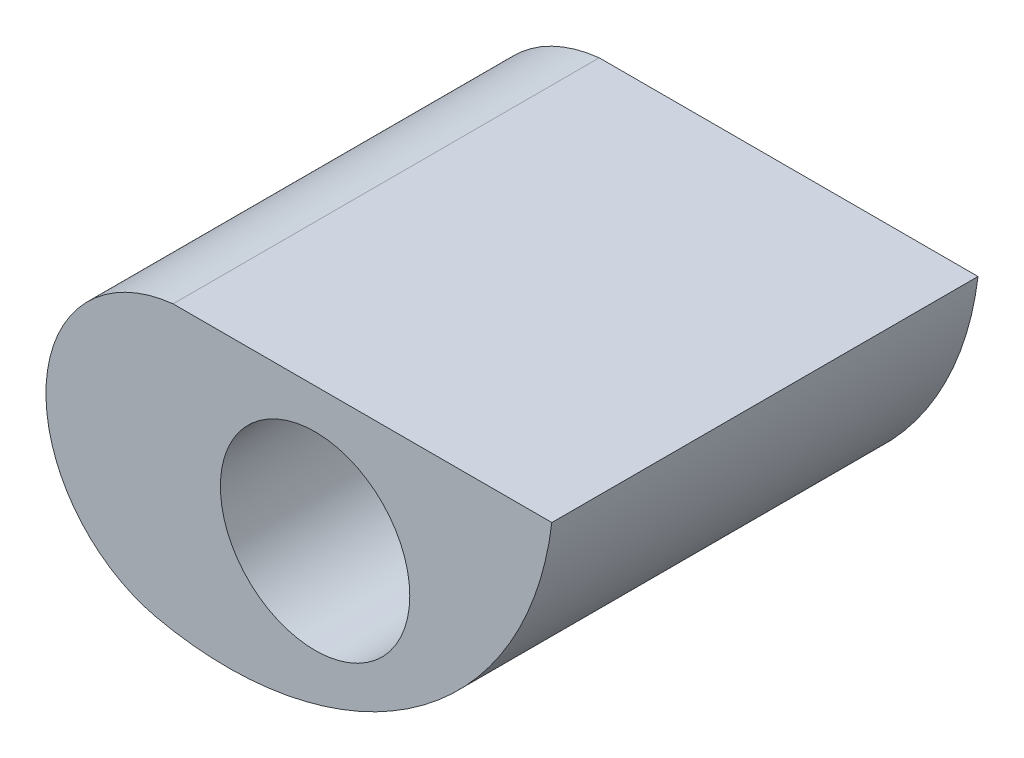
from build123d import *

# Parameters (mm, degrees)
BOSS_EXTRUDE1_DEPTH = 90
SHELL2_DEPTH        = 5
SKETCH4_R           = 20
CUT_EXTRUDE4_DEPTH  = 135.864371832
SKETCH5_R           = 22.5
SKETCH5_R_2         = 21
BOSS_EXTRUDE2_DEPTH = 3
CHAMFER1_SIZE       = 1
SKETCH6_R           = 20
BOSS_EXTRUDE3_DEPTH = 0.1
SKETCH7_R           = 5
CUT_EXTRUDE5_DEPTH  = 3


# Read off the part's stored shape, not the designer's step: Shell2
with BuildPart() as part:
    # Sketch2 → Boss-Extrude1 (new body)
    with BuildSketch(Plane.XY):
        with BuildLine():
            Line((80, 0), (0.013180824, 0))
            ThreePointArc((0.013180824, 0), (-26.775893479, -27.984672667), (-3.633537016, -59.052787248))
            ThreePointArc((-3.633537016, -59.052787248), (51.296073621, -48.097462301), (80, 0))
        make_face()
    extrude(amount=BOSS_EXTRUDE1_DEPTH)

    # Shell2 outline → Shell2 (cut)
    with BuildSketch(Plane.XY):
        with BuildLine():
            ThreePointArc((-3.187485366, -57.103146645), (49.216728462, -47.10575528), (77.70567898, -2))
            Line((77.70567898, -2), (0.120425847, -2))
            ThreePointArc((0.120425847, -2), (-24.782616289, -28.155901411), (-3.187485366, -57.103146645))
        make_face()
    extrude(amount=SHELL2_DEPTH, mode=Mode.SUBTRACT)

    # Sketch4 → Cut-Extrude4 (cut, through all)
    with BuildSketch(Plane.XY.offset(90)):
        with Locations((30, -28.386179716)):
            Circle(SKETCH4_R)
    extrude(amount=-CUT_EXTRUDE4_DEPTH, mode=Mode.SUBTRACT)

    # Sketch5 → Boss-Extrude2 (add)
    with BuildSketch(Plane(origin=(0, 0, 5), x_dir=(-1, 0, 0), z_dir=(0, 0, -1))):
        with Locations(Location((-30, -28.386179716, 0), (0, 0, 180))):
            Circle(SKETCH5_R)
        with Locations((-30, -28.386179716)):
            Circle(SKETCH5_R_2, mode=Mode.SUBTRACT)
    extrude(amount=BOSS_EXTRUDE2_DEPTH)

    # Chamfer1
    chamfer1_edges = [part.edges().sort_by_distance(p)[0] for p in [
        (51, -28.386179716, 2),
    ]]
    chamfer(chamfer1_edges, length=CHAMFER1_SIZE)

    # Sketch7 → Cut-Extrude5 (cut)
    with BuildSketch(Plane(origin=(0, 0, 5), x_dir=(-1, 0, 0), z_dir=(0, 0, -1))):
        with Locations((-0.120425847, -12)):
            Circle(SKETCH7_R)
    extrude(amount=-CUT_EXTRUDE5_DEPTH, mode=Mode.SUBTRACT)


with BuildPart() as body_2:
    # Sketch6 → Boss-Extrude3 (new body)
    with BuildSketch(Plane(origin=(0, 0, 5), x_dir=(-1, 0, 0), z_dir=(0, 0, -1))):
        with Locations((-30, -28.386179716)):
            Circle(SKETCH6_R)
    extrude(amount=BOSS_EXTRUDE3_DEPTH)


solid = Compound([part.part, body_2.part])
